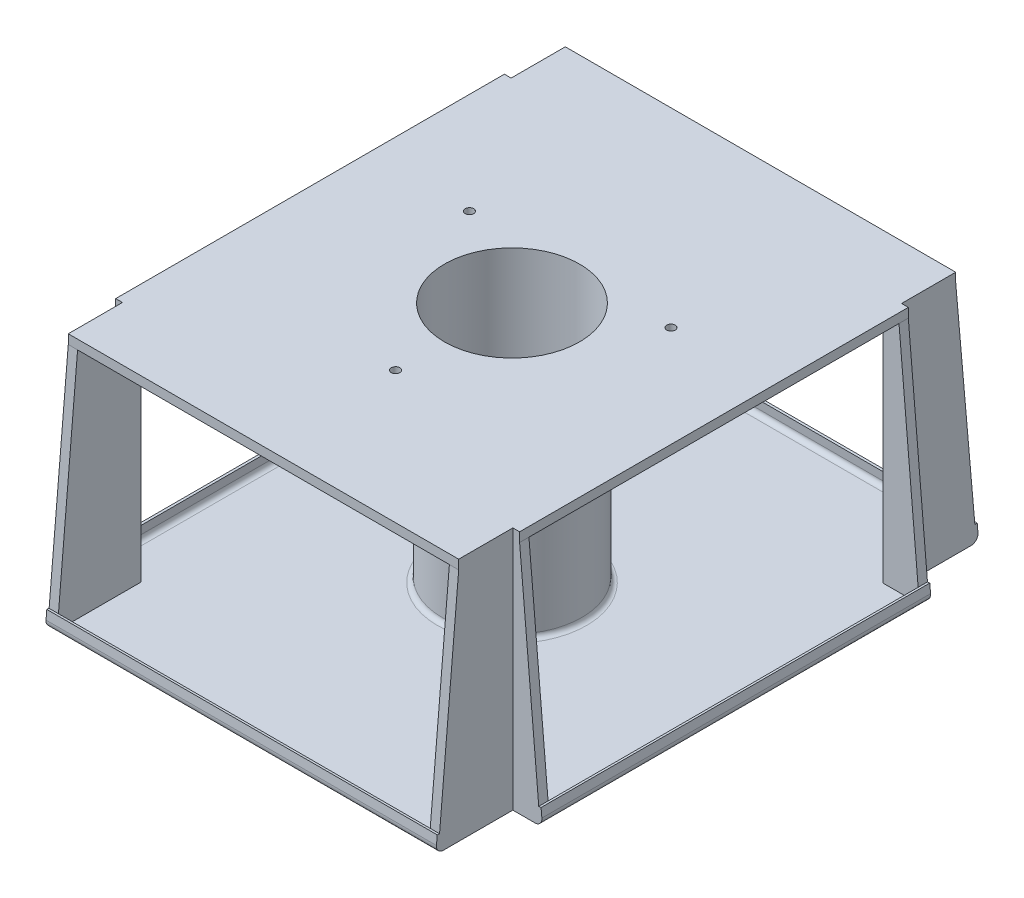
from build123d import *

# Parameters (mm, degrees)
BOSS_EXTRUDE1_DEPTH  = 5
EDGE_FLANGE1_START   = -417.4
EDGE_FLANGE1_DEPTH   = 834.8
EDGE_FLANGE1_START_2 = -419.24
EDGE_FLANGE1_2_DEPTH = 838.48
EDGE_FLANGE1_3_DEPTH = 834.8
EDGE_FLANGE1_4_DEPTH = 838.48
BOSS_EXTRUDE2_START  = -20
BOSS_EXTRUDE2_DEPTH  = 20
BOSS_EXTRUDE6_START  = -20
BOSS_EXTRUDE6_DEPTH  = 20
MIRROR2_START        = -20
MIRROR2_COPY_1_DEPTH = 20
MIRROR2_COPY_2_DEPTH = 20
BOSS_EXTRUDE7_DEPTH  = 20
CUT_EXTRUDE1_REACH   = 921.649
SKETCH21_R           = 9.25
BOSS_EXTRUDE8_REACH  = 918.804
SKETCH22_R           = 150
SKETCH23_R           = 145
CUT_EXTRUDE2_DEPTH   = 920.648675088
FILLET1_R            = 10


# Read off the part's stored shape, not the designer's step: Edge-Flange1
with BuildPart() as part:
    # Sketch1 → Boss-Extrude1 (new body)
    with BuildSketch(Plane(origin=(0, 0, 0), x_dir=(1, 0, 0), z_dir=(0, 1, 0))):
        Polygon((-419.24, -417.4), (-419.24, -582.5), (419.24, -582.5), (419.24, -417.4), (482.5, -417.4), (482.5, 417.4), (419.24, 417.4), (419.24, 582.5), (-419.24, 582.5), (-419.24, 417.4), (-482.5, 417.4), (-482.5, -417.4), align=None)
    extrude(amount=BOSS_EXTRUDE1_DEPTH)

    # Edge-Flange1 outline → Edge-Flange1 (add)
    with BuildSketch(Plane.XY.offset(EDGE_FLANGE1_START)):
        with BuildLine():
            Line((-479.84720202, 35.321619656), (-481.510736273, 16.307336141))
            ThreePointArc((-481.510736273, 16.307336141), (-480.800529715, 10.26398325), (-477.748155652, 4.999999958))
            Line((-477.748155652, 4.999999958), (-466.567815802, 5))
            ThreePointArc((-466.567815802, 5), (-473.94058917, 8.244097924), (-476.529762783, 15.871557427))
            Line((-476.529762783, 15.871557427), (-474.86622853, 34.885840943))
            Line((-474.86622853, 34.885840943), (-479.84720202, 35.321619656))
        make_face()
        with BuildLine():
            ThreePointArc((476.529762783, 15.871557427), (473.94058917, 8.244097924), (466.567815802, 5))
            Line((466.567815802, 5), (477.748155652, 4.999999958))
            ThreePointArc((477.748155652, 4.999999958), (480.800529715, 10.26398325), (481.510736273, 16.307336141))
            Line((481.510736273, 16.307336141), (479.84720202, 35.321619656))
            Line((479.84720202, 35.321619656), (474.86622853, 34.885840943))
            Line((474.86622853, 34.885840943), (476.529762783, 15.871557427))
        make_face()
    extrude(amount=EDGE_FLANGE1_DEPTH)

    # Edge-Flange1 2 outline → Edge-Flange1 2 (add)
    with BuildSketch(Plane.YZ.offset(EDGE_FLANGE1_START_2)):
        with BuildLine():
            Line((35.321619656, 579.84720202), (16.307336141, 581.510736273))
            ThreePointArc((16.307336141, 581.510736273), (10.263983245, 580.800529713), (4.99999995, 577.748155645))
            Line((4.99999995, 577.748155645), (5, 566.567815802))
            ThreePointArc((5, 566.567815802), (8.244097924, 573.94058917), (15.871557427, 576.529762783))
            Line((15.871557427, 576.529762783), (34.885840943, 574.86622853))
            Line((34.885840943, 574.86622853), (35.321619656, 579.84720202))
        make_face()
        with BuildLine():
            ThreePointArc((15.871557427, -576.529762783), (8.244097924, -573.94058917), (5, -566.567815802))
            Line((5, -566.567815802), (4.99999995, -577.748155645))
            ThreePointArc((4.99999995, -577.748155645), (10.263983245, -580.800529713), (16.307336141, -581.510736273))
            Line((16.307336141, -581.510736273), (35.321619656, -579.84720202))
            Line((35.321619656, -579.84720202), (34.885840943, -574.86622853))
            Line((34.885840943, -574.86622853), (15.871557427, -576.529762783))
        make_face()
    extrude(amount=EDGE_FLANGE1_2_DEPTH)

    # Edge-Flange1 3 outline → Edge-Flange1 3 (cut)
    with BuildSketch(Plane.XY.offset(EDGE_FLANGE1_START)):
        with BuildLine():
            ThreePointArc((-466.567815802, 0), (-472.691540133, 1.306936051), (-477.748155652, 4.999999958))
            Line((-477.748155652, 4.999999958), (-483, 4.999999958))
            Line((-483, 4.999999958), (-483, -2.2e-08))
            Line((-483, -2.2e-08), (-466.567815802, 0))
        make_face()
        with BuildLine():
            ThreePointArc((477.748155652, 4.999999958), (472.691540133, 1.306936051), (466.567815802, 0))
            Line((466.567815802, 0), (483, -2.2e-08))
            Line((483, -2.2e-08), (483, 4.999999958))
            Line((483, 4.999999958), (477.748155652, 4.999999958))
        make_face()
    extrude(amount=EDGE_FLANGE1_3_DEPTH, mode=Mode.SUBTRACT)

    # Edge-Flange1 4 outline → Edge-Flange1 4 (cut)
    with BuildSketch(Plane.YZ.offset(EDGE_FLANGE1_START_2)):
        with BuildLine():
            ThreePointArc((0, 566.567815802), (1.306936049, 572.691540128), (4.99999995, 577.748155645))
            Line((4.99999995, 577.748155645), (4.99999995, 583))
            Line((4.99999995, 583), (-2.7e-08, 583))
            Line((-2.7e-08, 583), (0, 566.567815802))
        make_face()
        with BuildLine():
            ThreePointArc((4.99999995, -577.748155645), (1.306936049, -572.691540128), (0, -566.567815802))
            Line((0, -566.567815802), (-2.7e-08, -583))
            Line((-2.7e-08, -583), (4.99999995, -583))
            Line((4.99999995, -583), (4.99999995, -577.748155645))
        make_face()
    extrude(amount=EDGE_FLANGE1_4_DEPTH, mode=Mode.SUBTRACT)

    # Sketch18 → Boss-Extrude2 (add)
    with BuildSketch(Plane(origin=(419.24, 0, 0), x_dir=(0, 0, -1), z_dir=(1, 0, 0)).offset(BOSS_EXTRUDE2_START)):
        with BuildLine():
            Line((-417.4, 5), (-566.567815802, 5))
            ThreePointArc((-566.567815802, 5), (-573.94058917, 8.244097924), (-576.529762783, 15.871557427))
            Line((-576.529762783, 15.871557427), (-533.736569049, 505))
            Line((-533.736569049, 505), (-417.4, 505))
            Line((-417.4, 505), (-417.4, 5))
        make_face()
    boss_extrude2 = extrude(amount=BOSS_EXTRUDE2_DEPTH)

    # Sketch19 → Boss-Extrude6 (add)
    with BuildSketch(Plane.XY.offset(417.4).offset(BOSS_EXTRUDE6_START)):
        with BuildLine():
            Line((466.567815802, 5), (419.24, 5))
            Line((419.24, 5), (399.24, 5))
            Line((399.24, 5), (399.24, 505))
            Line((399.24, 505), (419.24, 505))
            Line((419.24, 505), (433.736569049, 505))
            Line((433.736569049, 505), (476.529762783, 15.871557427))
            ThreePointArc((476.529762783, 15.871557427), (473.94058917, 8.244097924), (466.567815802, 5))
        make_face()
    boss_extrude6 = extrude(amount=BOSS_EXTRUDE6_DEPTH)

    # Mirror1: Boss-Extrude2, Boss-Extrude6 across plane
    add(boss_extrude2.mirror(Plane.XY))
    add(boss_extrude6.mirror(Plane.XY))

    # Mirror2: Boss-Extrude2, Boss-Extrude6 across plane
    add(boss_extrude2.mirror(Plane(origin=(0, 0, 0), x_dir=(0, 0, 1), z_dir=(1, 0, 0))))
    add(boss_extrude6.mirror(Plane(origin=(0, 0, 0), x_dir=(0, 0, 1), z_dir=(1, 0, 0))))

    # Mirror2 copy 1 sketch → Mirror2 copy 1 (add)
    with BuildSketch(Plane.ZY.offset(419.24).offset(MIRROR2_START)):
        with BuildLine():
            Line((-417.4, 5), (-566.567815802, 5))
            ThreePointArc((-566.567815802, 5), (-573.94058917, 8.244097924), (-576.529762783, 15.871557427))
            Line((-576.529762783, 15.871557427), (-533.736569049, 505))
            Line((-533.736569049, 505), (-417.4, 505))
            Line((-417.4, 505), (-417.4, 5))
        make_face()
    extrude(amount=MIRROR2_COPY_1_DEPTH)

    # Mirror2 copy 2 sketch → Mirror2 copy 2 (add)
    with BuildSketch(Plane(origin=(0, 0, -417.4), x_dir=(-1, 0, 0), z_dir=(0, 0, -1)).offset(MIRROR2_START)):
        with BuildLine():
            Line((466.567815802, 5), (419.24, 5))
            Line((419.24, 5), (399.24, 5))
            Line((399.24, 5), (399.24, 505))
            Line((399.24, 505), (419.24, 505))
            Line((419.24, 505), (433.736569049, 505))
            Line((433.736569049, 505), (476.529762783, 15.871557427))
            ThreePointArc((476.529762783, 15.871557427), (473.94058917, 8.244097924), (466.567815802, 5))
        make_face()
    extrude(amount=MIRROR2_COPY_2_DEPTH)

    # Sketch20 → Boss-Extrude7 (add)
    with BuildSketch(Plane(origin=(0, 505, 0), x_dir=(1, 0, 0), z_dir=(0, 1, 0))):
        Polygon((-419.24, -417.4), (-419.24, -533.736569049), (419.24, -533.736569049), (419.24, -417.4), (433.736569049, -417.4), (433.736569049, 417.4), (419.24, 417.4), (419.24, 533.736569049), (-419.24, 533.736569049), (-419.24, 417.4), (-433.736569049, 417.4), (-433.736569049, -417.4), align=None)
    extrude(amount=BOSS_EXTRUDE7_DEPTH)

    # Sketch21 → Cut-Extrude1 (cut, up to next)
    with BuildSketch(Plane(origin=(0, 525, 0), x_dir=(1, 0, 0), z_dir=(0, 1, 0)), mode=Mode.PRIVATE) as cut_extrude1_sk1:
        with Locations(Location((0, -249.998440062, 0), (0, 0, 270))):
            Circle(SKETCH21_R)
    cut_extrude1_tool1 = extrude(cut_extrude1_sk1.sketch, amount=-CUT_EXTRUDE1_REACH, mode=Mode.PRIVATE) & part.part
    # Sketch21 → Cut-Extrude1 (cut, up to next)
    with BuildSketch(Plane(origin=(0, 525, 0), x_dir=(1, 0, 0), z_dir=(0, 1, 0)), mode=Mode.PRIVATE) as cut_extrude1_sk2:
        with Locations(Location((-216.505, 124.999220031, 0), (0, 0, 270))):
            Circle(SKETCH21_R)
    cut_extrude1_tool2 = extrude(cut_extrude1_sk2.sketch, amount=-CUT_EXTRUDE1_REACH, mode=Mode.PRIVATE) & part.part
    # Sketch21 → Cut-Extrude1 (cut, up to next)
    with BuildSketch(Plane(origin=(0, 525, 0), x_dir=(1, 0, 0), z_dir=(0, 1, 0)), mode=Mode.PRIVATE) as cut_extrude1_sk3:
        with Locations(Location((216.505, 124.999220031, 0), (0, 0, 270))):
            Circle(SKETCH21_R)
    cut_extrude1_tool3 = extrude(cut_extrude1_sk3.sketch, amount=-CUT_EXTRUDE1_REACH, mode=Mode.PRIVATE) & part.part
    add(cut_extrude1_tool1.solids().sort_by_distance((0, 525, 249.99844))[0], mode=Mode.SUBTRACT)
    add(cut_extrude1_tool2.solids().sort_by_distance((-216.505, 525, -124.99922))[0], mode=Mode.SUBTRACT)
    add(cut_extrude1_tool3.solids().sort_by_distance((216.505, 525, -124.99922))[0], mode=Mode.SUBTRACT)

    # Sketch22 → Boss-Extrude8 (add, up to next)
    with BuildSketch(Plane(origin=(0, 5, 0), x_dir=(1, 0, 0), z_dir=(0, 1, 0)), mode=Mode.PRIVATE) as boss_extrude8_sk1:
        with Locations(Location((0, 0, 0), (0, 0, 270))):
            Circle(SKETCH22_R)
    boss_extrude8_tool1 = extrude(boss_extrude8_sk1.sketch, amount=BOSS_EXTRUDE8_REACH, mode=Mode.PRIVATE) - part.part
    add(boss_extrude8_tool1.solids().sort_by_distance((0, 5, 0))[0])

    # Sketch23 → Cut-Extrude2 (cut, through all)
    with BuildSketch(Plane(origin=(0, 525, 0), x_dir=(1, 0, 0), z_dir=(0, 1, 0))):
        with Locations(Location((0, 0, 0), (0, 0, 270))):
            Circle(SKETCH23_R)
    extrude(amount=-CUT_EXTRUDE2_DEPTH, mode=Mode.SUBTRACT)

    # Fillet1
    fillet1_edges = [part.edges().sort_by_distance(p)[0] for p in [
        (0, 505, -150),
        (0, 5, -150),
    ]]
    fillet(fillet1_edges, radius=FILLET1_R)


solid = part.part
